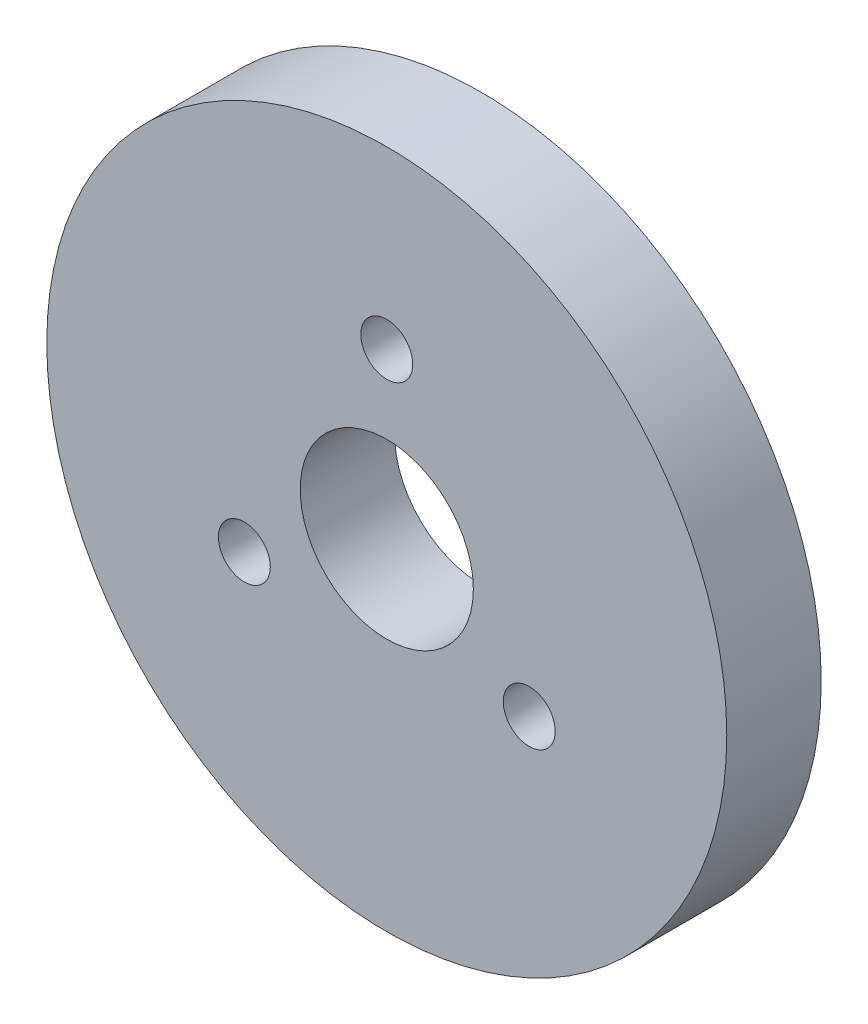
from build123d import *

# Parameters (mm, degrees)
SKETCH1_R           = 21.6
SKETCH1_R_2         = 5.5
BOSS_EXTRUDE1_DEPTH = 6
SKETCH2_R           = 1.65
CUT_EXTRUDE1_DEPTH  = 3


with BuildPart() as part:
    # Sketch1 → Boss-Extrude1 (new body)
    with BuildSketch(Plane.XY):
        Circle(SKETCH1_R)
        Circle(SKETCH1_R_2, mode=Mode.SUBTRACT)
    extrude(amount=BOSS_EXTRUDE1_DEPTH)

    # Sketch2 → Cut-Extrude1 (cut)
    with BuildSketch(Plane.XY.offset(6)):
        with Locations((0, 10.45)):
            Circle(SKETCH2_R)
        with Locations((9.04996547, -5.225)):
            Circle(SKETCH2_R)
        with Locations((-9.04996547, -5.225)):
            Circle(SKETCH2_R)
    extrude(amount=-CUT_EXTRUDE1_DEPTH, mode=Mode.SUBTRACT)


solid = part.part
